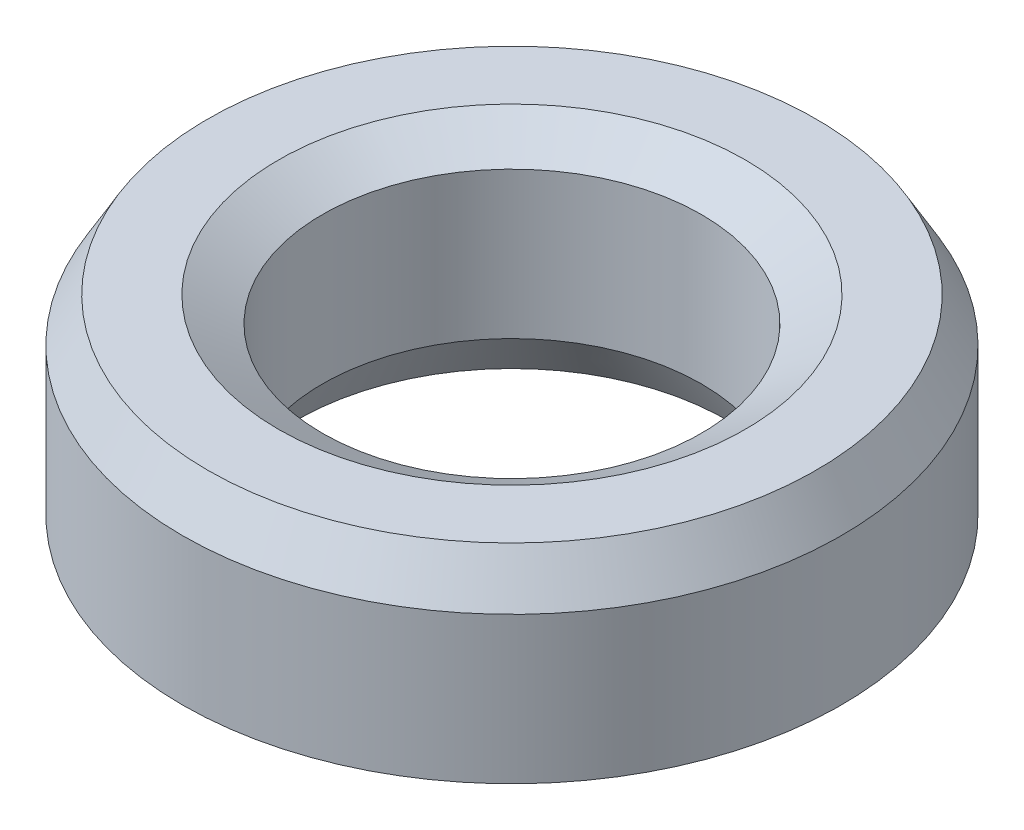
from build123d import *
from OCP.BRepFilletAPI import BRepFilletAPI_MakeChamfer

# Parameters (mm, degrees)
SKETCH1_R           = 25
BOSS_EXTRUDE1_DEPTH = 16.380699025
SKETCH2_R           = 14.376423109
CUT_EXTRUDE1_DEPTH  = 39.965719556
CHAMFER1_SIZE       = 3.329508701
CHAMFER1_SIZE2      = 1.922292745


with BuildPart() as part:
    # Sketch1 → Boss-Extrude1 (new body)
    with BuildSketch(Plane(origin=(0, 0, 0), x_dir=(1, 0, 0), z_dir=(0, 1, 0))):
        Circle(SKETCH1_R)
    extrude(amount=BOSS_EXTRUDE1_DEPTH)

    # Sketch2 → Cut-Extrude1 (cut, through all)
    with BuildSketch(Plane(origin=(0, 0, 0), x_dir=(1, 0, 0), z_dir=(0, 1, 0))):
        Circle(SKETCH2_R)
    extrude(amount=CUT_EXTRUDE1_DEPTH, mode=Mode.SUBTRACT)

    # Chamfer1: one chamfer whose edges measure the first distance from different faces: ONE call of the kernel's chamfer builder (chamfer() names one face for all edges)
    chamfer1_edges_1 = [part.edges().sort_by_distance(p)[0] for p in [
        (-14.376423109, 16.380699025, 0),
    ]]
    chamfer1_side_1 = [part.faces().sort_by_distance(p)[0] for p in [
        (-24.292893219, 16.380699025, 0),
    ]]
    chamfer1_edges_2 = [part.edges().sort_by_distance(p)[0] for p in [
        (-14.376423109, 0, 0),
    ]]
    chamfer1_side_2 = [part.faces().sort_by_distance(p)[0] for p in [
        (-14.376423109, 8.190349512, 0),
    ]]
    chamfer1_edges_3 = [part.edges().sort_by_distance(p)[0] for p in [
        (-25, 0, 0),
    ]]
    chamfer1_side_3 = [part.faces().sort_by_distance(p)[0] for p in [
        (-24.292893219, 0, 0),
    ]]
    chamfer1_edges_4 = [part.edges().sort_by_distance(p)[0] for p in [
        (-25, 16.380699025, 0),
    ]]
    chamfer1_side_4 = [part.faces().sort_by_distance(p)[0] for p in [
        (-25, 8.190349512, 0),
    ]]
    chamfer1 = BRepFilletAPI_MakeChamfer(part.part.solid().wrapped)
    for e in chamfer1_edges_1:
        chamfer1.Add(CHAMFER1_SIZE, CHAMFER1_SIZE2, e.wrapped, chamfer1_side_1[0].wrapped)  # the first distance lies on this face
    for e in chamfer1_edges_2:
        chamfer1.Add(CHAMFER1_SIZE, CHAMFER1_SIZE2, e.wrapped, chamfer1_side_2[0].wrapped)  # the first distance lies on this face
    for e in chamfer1_edges_3:
        chamfer1.Add(CHAMFER1_SIZE, CHAMFER1_SIZE2, e.wrapped, chamfer1_side_3[0].wrapped)  # the first distance lies on this face
    for e in chamfer1_edges_4:
        chamfer1.Add(CHAMFER1_SIZE, CHAMFER1_SIZE2, e.wrapped, chamfer1_side_4[0].wrapped)  # the first distance lies on this face
    add(Compound.cast(chamfer1.Shape()), mode=Mode.REPLACE)


solid = part.part
